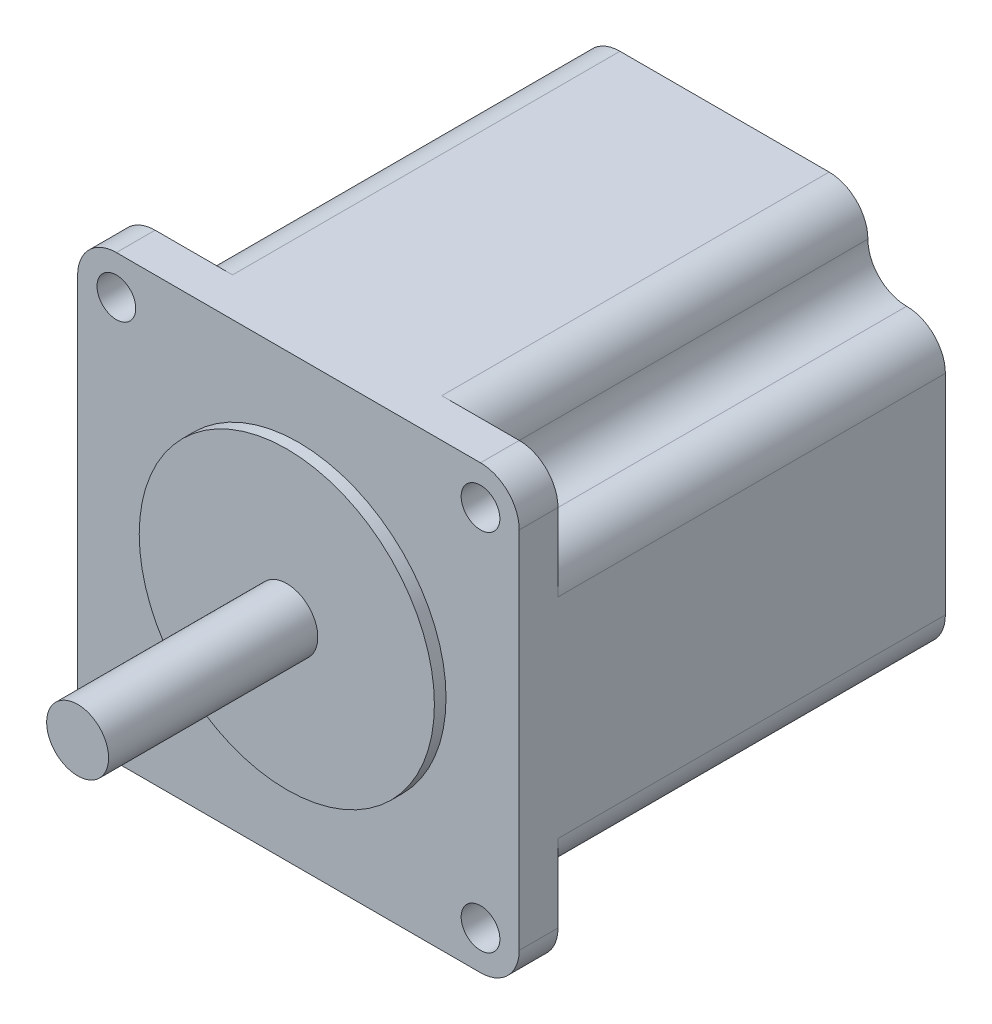
from build123d import *

# Parameters (mm, degrees)
SKETCH1_W            = 57
SKETCH1_H            = 57
BOSS_EXTRUDE1_DEPTH  = 55
SKETCH2_W            = 10
SKETCH2_H            = 10
CUT_EXTRUDE1_DEPTH   = 50
LPATTERN1_COUNT      = 2
LPATTERN1_PITCH      = 47
LPATTERN1_COUNT_DIR2 = 2
LPATTERN1_PITCH_DIR2 = 47
SKETCH3_R            = 2.5
CUT_EXTRUDE2_DEPTH   = 50
LPATTERN2_COUNT      = 2
LPATTERN2_PITCH      = 47
LPATTERN2_COUNT_DIR2 = 2
LPATTERN2_PITCH_DIR2 = 47
FILLET1_R            = 5
SKETCH5_R            = 19.05
BOSS_EXTRUDE3_DEPTH  = 1.5
SKETCH4_R            = 4
BOSS_EXTRUDE2_DEPTH  = 28.5


with BuildPart() as part:
    # Sketch1 → Boss-Extrude1 (new body)
    with BuildSketch(Plane.XY):
        with Locations((-4.861204013, 2.764214047)):
            Rectangle(SKETCH1_W, SKETCH1_H)
    extrude(amount=BOSS_EXTRUDE1_DEPTH)

    # Sketch2 → Cut-Extrude1 (cut)
    with BuildSketch(Plane(origin=(0, 0, 0), x_dir=(-1, 0, 0), z_dir=(0, 0, -1))):
        with Locations((-18.638795987, 26.264214047)):
            Rectangle(SKETCH2_W, SKETCH2_H)
    cut_extrude1 = extrude(amount=-CUT_EXTRUDE1_DEPTH, mode=Mode.SUBTRACT)

    # LPattern1: Cut-Extrude1 2 × 2
    with Locations(*[(-i * LPATTERN1_PITCH, -j * LPATTERN1_PITCH_DIR2, 0) for i in range(LPATTERN1_COUNT) for j in range(LPATTERN1_COUNT_DIR2) if (i, j) != (0, 0)]):
        add(cut_extrude1, mode=Mode.SUBTRACT)

    # Sketch3 → Cut-Extrude2 (cut)
    with BuildSketch(Plane.XY.offset(55)):
        with Locations((-28.361204013, 26.264214047)):
            Circle(SKETCH3_R)
    cut_extrude2 = extrude(amount=-CUT_EXTRUDE2_DEPTH, mode=Mode.SUBTRACT)

    # LPattern2: Cut-Extrude2 2 × 2
    with Locations(*[(i * LPATTERN2_PITCH, -j * LPATTERN2_PITCH_DIR2, 0) for i in range(LPATTERN2_COUNT) for j in range(LPATTERN2_COUNT_DIR2) if (i, j) != (0, 0)]):
        add(cut_extrude2, mode=Mode.SUBTRACT)

    # Fillet1
    fillet1_edges = [part.edges().sort_by_distance(p)[0] for p in [
        (-33.361204013, 21.264214047, 25),
        (-23.361204013, 21.264214047, 25),
        (-23.361204013, 31.264214047, 25),
        (13.638795987, 31.264214047, 25),
        (13.638795987, 21.264214047, 25),
        (23.638795987, 21.264214047, 25),
        (23.638795987, -25.735785953, 52.5),
        (23.638795987, -15.735785953, 25),
        (13.638795987, -15.735785953, 25),
        (13.638795987, -25.735785953, 25),
        (-23.361204013, -25.735785953, 25),
        (-23.361204013, -15.735785953, 25),
        (-33.361204013, -15.735785953, 25),
        (-33.361204013, -25.735785953, 52.5),
        (-33.361204013, 31.264214047, 52.5),
        (23.638795987, 31.264214047, 52.5),
    ]]
    fillet(fillet1_edges, radius=FILLET1_R - 0.0001)  # a hair under: the kernel refuses the full size

    # Sketch5 → Boss-Extrude3 (add)
    with BuildSketch(Plane.XY.offset(55)):
        with Locations((-4.861204013, 2.764214047)):
            Circle(SKETCH5_R)
    extrude(amount=BOSS_EXTRUDE3_DEPTH)

    # Sketch4 → Boss-Extrude2 (add)
    with BuildSketch(Plane.XY.offset(55)):
        with Locations(Location((-4.861204013, 2.764214047, 0), (0, 0, 180))):
            Circle(SKETCH4_R)
    extrude(amount=BOSS_EXTRUDE2_DEPTH)


solid = part.part
